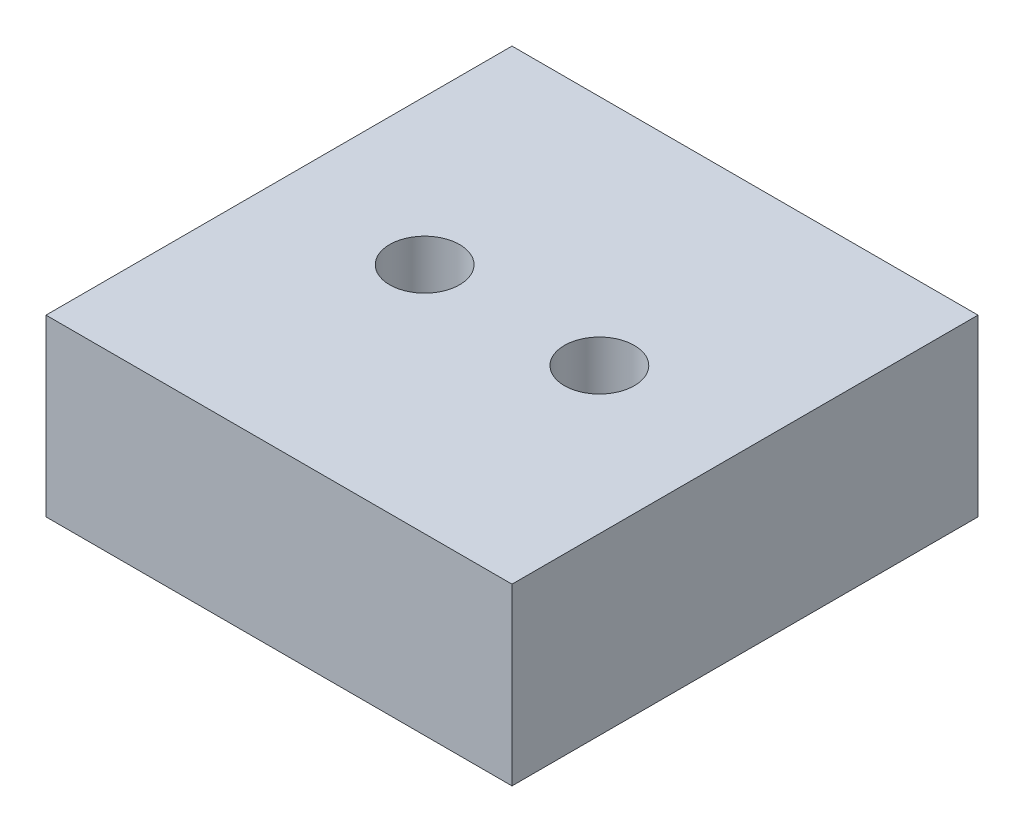
from build123d import *

# Parameters (mm, degrees)
SKETCH1_W           = 40
SKETCH1_H           = 40
SKETCH1_R           = 3
BOSS_EXTRUDE1_DEPTH = 15


with BuildPart() as part:
    # Sketch1 → Boss-Extrude1 (new body)
    with BuildSketch(Plane(origin=(0, 0, 0), x_dir=(1, 0, 0), z_dir=(0, 1, 0))):
        Rectangle(SKETCH1_W, SKETCH1_H)
        with Locations((-7.5, 0)):
            Circle(SKETCH1_R, mode=Mode.SUBTRACT)
        with Locations((7.5, 0)):
            Circle(SKETCH1_R, mode=Mode.SUBTRACT)
    extrude(amount=BOSS_EXTRUDE1_DEPTH)


solid = part.part
